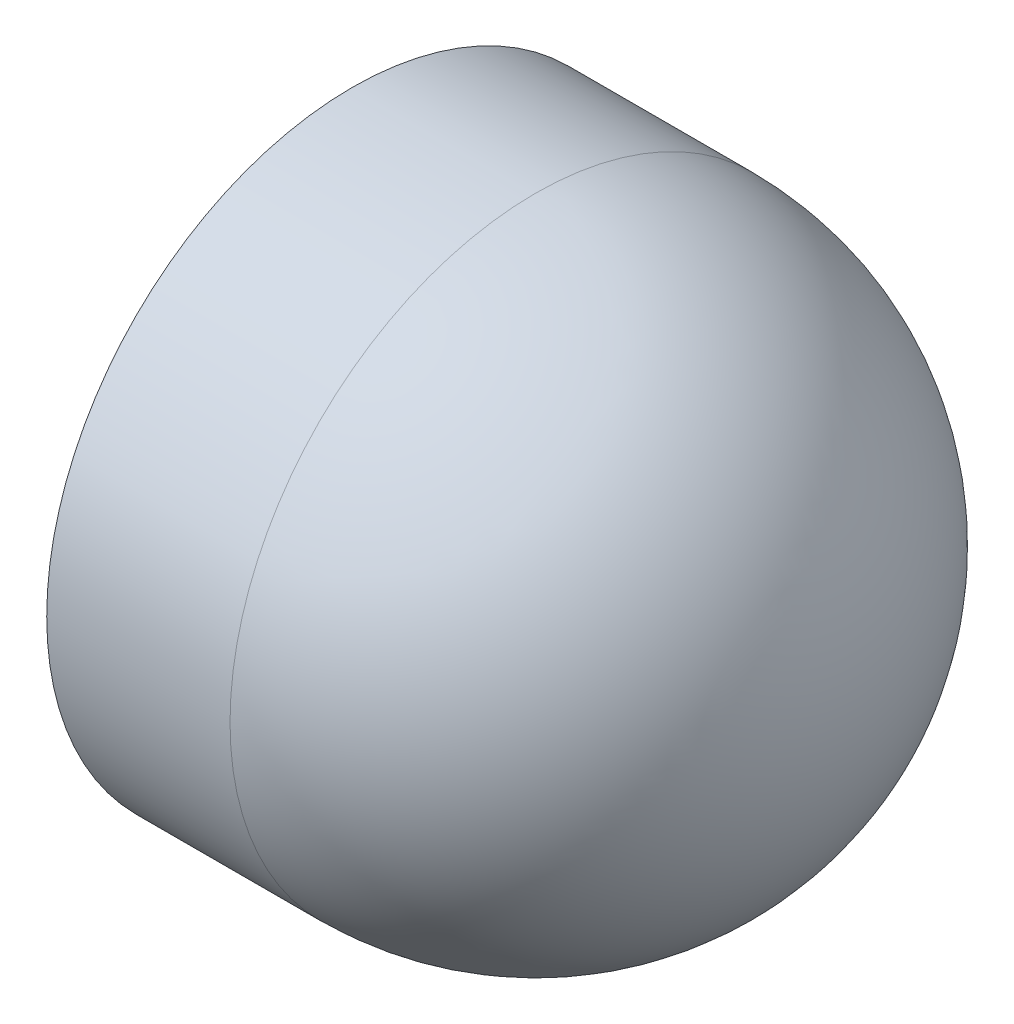
from build123d import *

# Parameters (mm, degrees)
CUT_EXTRUDE1_DEPTH = 2.75
SKETCH3_R          = 1.127
CUT_EXTRUDE2_DEPTH = 2.1


with BuildPart() as part:
    # Sketch1 → Revolve1 (revolve)
    with BuildSketch(Plane.XY):
        with BuildLine():
            Line((0, 0), (12, 0))
            ThreePointArc((12, 0), (9.803300859, -5.303300859), (4.5, -7.5))
            Line((4.5, -7.5), (0, -7.5))
            Line((0, -7.5), (0, 0))
        make_face()
    revolve(axis=Axis((0, 0, 0), (1, 0, 0)))

    # Sketch2 → Cut-Extrude1 (cut)
    with BuildSketch(Plane.ZY):
        Polygon((2.050748156, 3.552), (-2.050748156, 3.552), (-4.101496312, 0), (-2.050748156, -3.552), (2.050748156, -3.552), (4.101496312, 0), align=None)
    extrude(amount=-CUT_EXTRUDE1_DEPTH, mode=Mode.SUBTRACT)

    # Sketch3 → Cut-Extrude2 (cut)
    with BuildSketch(Plane.ZY):
        with Locations((-4.763139721, -2.75)):
            Circle(SKETCH3_R)
        with Locations((0, 5.5)):
            Circle(SKETCH3_R)
        with Locations((4.763139721, -2.75)):
            Circle(SKETCH3_R)
    extrude(amount=-CUT_EXTRUDE2_DEPTH, mode=Mode.SUBTRACT)


solid = part.part
